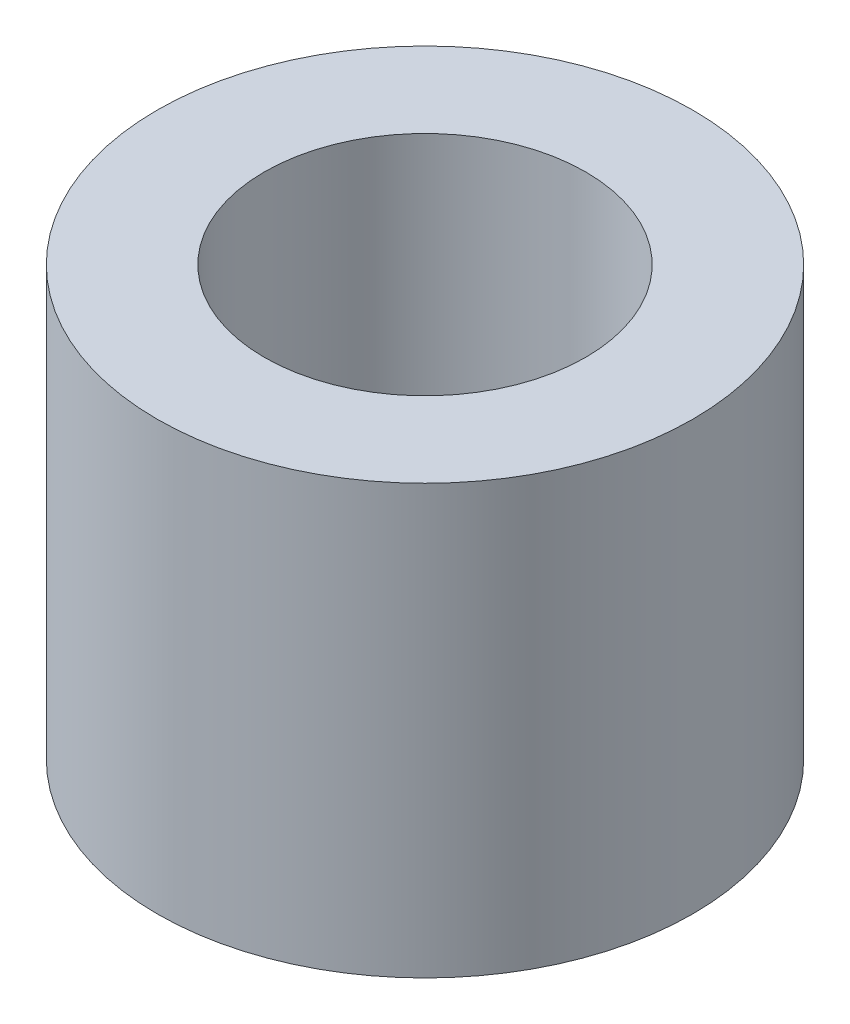
from build123d import *

# Parameters (mm, degrees)
SKETCH1_R           = 2.5
SKETCH1_R_2         = 1.5
BOSS_EXTRUDE1_DEPTH = 2


with BuildPart() as part:
    # Sketch1 → Boss-Extrude1 (new, symmetric)
    with BuildSketch(Plane(origin=(0, 0, 0), x_dir=(1, 0, 0), z_dir=(0, 1, 0))):
        Circle(SKETCH1_R)
        Circle(SKETCH1_R_2, mode=Mode.SUBTRACT)
    extrude(amount=BOSS_EXTRUDE1_DEPTH, both=True)


solid = part.part
